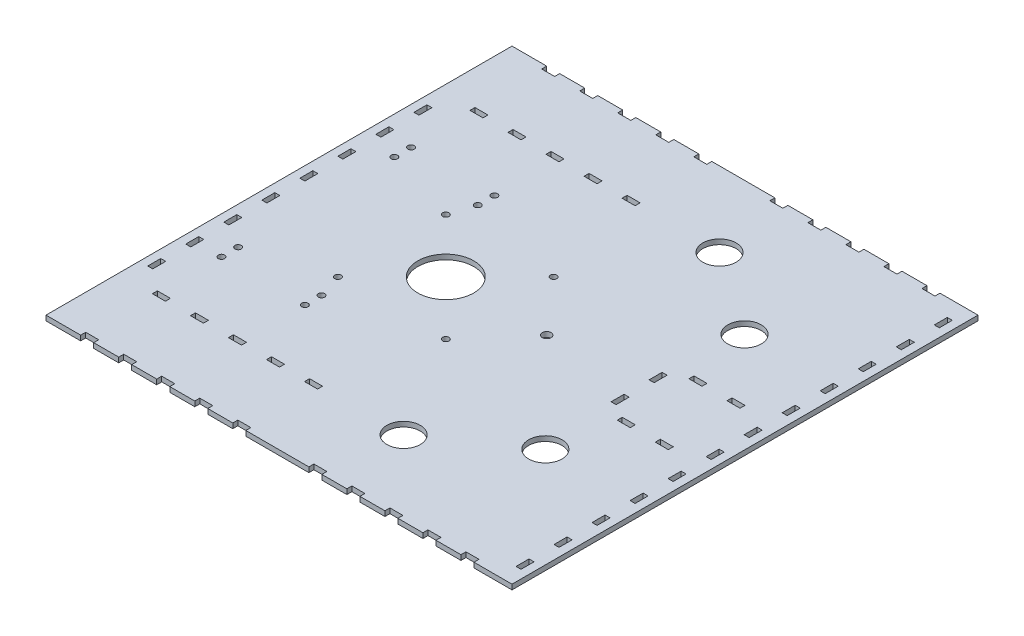
from build123d import *

# Parameters (mm, degrees)
SKETCH1_W                = 279.4
SKETCH1_H                = 279.4
BOSS_EXTRUDE1_DEPTH      = 3
SKETCH3_W                = 3
SKETCH3_H                = 7.8
CUT_EXTRUDE2_DEPTH       = 198.588410591
LPATTERN1_COUNT          = 12
LPATTERN1_PITCH          = 22.8
SKETCH5_W                = 7.8
SKETCH5_H                = 3
CUT_EXTRUDE3_DEPTH       = 198.588410591
LPATTERN2_COUNT          = 11
LPATTERN2_PITCH          = 22.8
MIRROR2_COPY_1_SKETCH_W  = 7.8
MIRROR2_COPY_1_SKETCH_H  = 3
MIRROR2_COPY_1_DEPTH     = 198.588410591
MIRROR2_COPY_2_SKETCH_W  = 7.8
MIRROR2_COPY_2_SKETCH_H  = 3
MIRROR2_COPY_2_DEPTH     = 198.588410591
MIRROR2_COPY_3_SKETCH_W  = 7.8
MIRROR2_COPY_3_SKETCH_H  = 3
MIRROR2_COPY_3_DEPTH     = 198.588410591
MIRROR2_COPY_4_SKETCH_W  = 7.8
MIRROR2_COPY_4_SKETCH_H  = 3
MIRROR2_COPY_4_DEPTH     = 198.588410591
MIRROR2_COPY_5_SKETCH_W  = 7.8
MIRROR2_COPY_5_SKETCH_H  = 3
MIRROR2_COPY_5_DEPTH     = 198.588410591
MIRROR2_COPY_6_SKETCH_W  = 7.8
MIRROR2_COPY_6_SKETCH_H  = 3
MIRROR2_COPY_6_DEPTH     = 198.588410591
MIRROR2_COPY_7_SKETCH_W  = 7.8
MIRROR2_COPY_7_SKETCH_H  = 3
MIRROR2_COPY_7_DEPTH     = 198.588410591
MIRROR2_COPY_8_SKETCH_W  = 7.8
MIRROR2_COPY_8_SKETCH_H  = 3
MIRROR2_COPY_8_DEPTH     = 198.588410591
MIRROR2_COPY_9_SKETCH_W  = 7.8
MIRROR2_COPY_9_SKETCH_H  = 3
MIRROR2_COPY_9_DEPTH     = 198.588410591
MIRROR2_COPY_10_SKETCH_W = 7.8
MIRROR2_COPY_10_SKETCH_H = 3
MIRROR2_COPY_10_DEPTH    = 198.588410591
SKETCH6_W                = 3
SKETCH6_H                = 7.8
CUT_EXTRUDE4_DEPTH       = 198.588410591
LPATTERN3_COUNT          = 8
LPATTERN3_PITCH          = 22.8
SKETCH7_R                = 16.75
CUT_EXTRUDE5_DEPTH       = 198.588410591
F_6_CLEARANCE_HOLE1_D    = 3.7973
F_6_CLEARANCE_HOLE2_D    = 3.7973
SKETCH14_R               = 2.65
CUT_EXTRUDE6_DEPTH       = 198.588410591
SKETCH16_W               = 7.8
SKETCH16_H               = 3
CUT_EXTRUDE8_DEPTH       = 198.588410591
LPATTERN5_COUNT          = 5
LPATTERN5_PITCH          = 22.8
MIRROR4_COPY_1_SKETCH_W  = 7.8
MIRROR4_COPY_1_SKETCH_H  = 3
MIRROR4_COPY_1_DEPTH     = 198.588410591
MIRROR4_COPY_2_SKETCH_W  = 7.8
MIRROR4_COPY_2_SKETCH_H  = 3
MIRROR4_COPY_2_DEPTH     = 198.588410591
MIRROR4_COPY_3_SKETCH_W  = 7.8
MIRROR4_COPY_3_SKETCH_H  = 3
MIRROR4_COPY_3_DEPTH     = 198.588410591
MIRROR4_COPY_4_SKETCH_W  = 7.8
MIRROR4_COPY_4_SKETCH_H  = 3
MIRROR4_COPY_4_DEPTH     = 198.588410591
MIRROR4_COPY_5_SKETCH_W  = 7.8
MIRROR4_COPY_5_SKETCH_H  = 3
MIRROR4_COPY_5_DEPTH     = 198.588410591
SKETCH17_W               = 7.8
SKETCH17_H               = 3
CUT_EXTRUDE9_DEPTH       = 198.588410591
LPATTERN6_COUNT          = 2
LPATTERN6_PITCH          = 22.8
SKETCH18_W               = 3
SKETCH18_H               = 7.8
CUT_EXTRUDE10_DEPTH      = 198.588410591
MIRROR5_COPY_1_SKETCH_W  = 7.8
MIRROR5_COPY_1_SKETCH_H  = 3
MIRROR5_COPY_1_DEPTH     = 198.588410591
SKETCH19_R               = 10
CUT_EXTRUDE11_DEPTH      = 198.588410591


with BuildPart() as part:
    # Sketch1 → Boss-Extrude1 (new body)
    with BuildSketch(Plane(origin=(0, 0, 0), x_dir=(1, 0, 0), z_dir=(0, 1, 0))):
        Rectangle(SKETCH1_W, SKETCH1_H)
    extrude(amount=BOSS_EXTRUDE1_DEPTH)

    # Sketch3 → Cut-Extrude2 (cut, through all)
    with BuildSketch(Plane(origin=(0, 0, 0), x_dir=(-1, 0, 0), z_dir=(0, -1, 0))):
        with Locations((-133.2, 125.4)):
            Rectangle(SKETCH3_W, SKETCH3_H)
    cut_extrude2 = extrude(amount=-CUT_EXTRUDE2_DEPTH, mode=Mode.SUBTRACT)

    # LPattern1: Cut-Extrude2 ×12
    with Locations(*[(0, 0, i * LPATTERN1_PITCH) for i in range(1, LPATTERN1_COUNT)]):
        add(cut_extrude2, mode=Mode.SUBTRACT)

    # Sketch5 → Cut-Extrude3 (cut, through all)
    with BuildSketch(Plane.XZ):
        with Locations((113, -138.2)):
            Rectangle(SKETCH5_W, SKETCH5_H)
    cut_extrude3 = extrude(amount=-CUT_EXTRUDE3_DEPTH, mode=Mode.SUBTRACT)

    # LPattern2: Cut-Extrude3 ×11, 1 skipped
    with Locations(*[(-i * LPATTERN2_PITCH, 0, 0) for i in range(1, LPATTERN2_COUNT) if i not in (5,)]):
        add(cut_extrude3, mode=Mode.SUBTRACT)

    # Mirror2 copy 1 sketch → Mirror2 copy 1 (cut, through all)
    with BuildSketch(Plane(origin=(-22.8, 0, 0), x_dir=(1, 0, 0), z_dir=(0, -1, 0))):
        with Locations((113, 138.2)):
            Rectangle(MIRROR2_COPY_1_SKETCH_W, MIRROR2_COPY_1_SKETCH_H)
    extrude(amount=-MIRROR2_COPY_1_DEPTH, mode=Mode.SUBTRACT)

    # Mirror2 copy 2 sketch → Mirror2 copy 2 (cut, through all)
    with BuildSketch(Plane(origin=(-45.6, 0, 0), x_dir=(1, 0, 0), z_dir=(0, -1, 0))):
        with Locations((113, 138.2)):
            Rectangle(MIRROR2_COPY_2_SKETCH_W, MIRROR2_COPY_2_SKETCH_H)
    extrude(amount=-MIRROR2_COPY_2_DEPTH, mode=Mode.SUBTRACT)

    # Mirror2 copy 3 sketch → Mirror2 copy 3 (cut, through all)
    with BuildSketch(Plane(origin=(-68.4, 0, 0), x_dir=(1, 0, 0), z_dir=(0, -1, 0))):
        with Locations((113, 138.2)):
            Rectangle(MIRROR2_COPY_3_SKETCH_W, MIRROR2_COPY_3_SKETCH_H)
    extrude(amount=-MIRROR2_COPY_3_DEPTH, mode=Mode.SUBTRACT)

    # Mirror2 copy 4 sketch → Mirror2 copy 4 (cut, through all)
    with BuildSketch(Plane(origin=(-91.2, 0, 0), x_dir=(1, 0, 0), z_dir=(0, -1, 0))):
        with Locations((113, 138.2)):
            Rectangle(MIRROR2_COPY_4_SKETCH_W, MIRROR2_COPY_4_SKETCH_H)
    extrude(amount=-MIRROR2_COPY_4_DEPTH, mode=Mode.SUBTRACT)

    # Mirror2 copy 5 sketch → Mirror2 copy 5 (cut, through all)
    with BuildSketch(Plane(origin=(-136.8, 0, 0), x_dir=(1, 0, 0), z_dir=(0, -1, 0))):
        with Locations((113, 138.2)):
            Rectangle(MIRROR2_COPY_5_SKETCH_W, MIRROR2_COPY_5_SKETCH_H)
    extrude(amount=-MIRROR2_COPY_5_DEPTH, mode=Mode.SUBTRACT)

    # Mirror2 copy 6 sketch → Mirror2 copy 6 (cut, through all)
    with BuildSketch(Plane(origin=(-159.6, 0, 0), x_dir=(1, 0, 0), z_dir=(0, -1, 0))):
        with Locations((113, 138.2)):
            Rectangle(MIRROR2_COPY_6_SKETCH_W, MIRROR2_COPY_6_SKETCH_H)
    extrude(amount=-MIRROR2_COPY_6_DEPTH, mode=Mode.SUBTRACT)

    # Mirror2 copy 7 sketch → Mirror2 copy 7 (cut, through all)
    with BuildSketch(Plane(origin=(-182.4, 0, 0), x_dir=(1, 0, 0), z_dir=(0, -1, 0))):
        with Locations((113, 138.2)):
            Rectangle(MIRROR2_COPY_7_SKETCH_W, MIRROR2_COPY_7_SKETCH_H)
    extrude(amount=-MIRROR2_COPY_7_DEPTH, mode=Mode.SUBTRACT)

    # Mirror2 copy 8 sketch → Mirror2 copy 8 (cut, through all)
    with BuildSketch(Plane(origin=(-205.2, 0, 0), x_dir=(1, 0, 0), z_dir=(0, -1, 0))):
        with Locations((113, 138.2)):
            Rectangle(MIRROR2_COPY_8_SKETCH_W, MIRROR2_COPY_8_SKETCH_H)
    extrude(amount=-MIRROR2_COPY_8_DEPTH, mode=Mode.SUBTRACT)

    # Mirror2 copy 9 sketch → Mirror2 copy 9 (cut, through all)
    with BuildSketch(Plane(origin=(-228, 0, 0), x_dir=(1, 0, 0), z_dir=(0, -1, 0))):
        with Locations((113, 138.2)):
            Rectangle(MIRROR2_COPY_9_SKETCH_W, MIRROR2_COPY_9_SKETCH_H)
    extrude(amount=-MIRROR2_COPY_9_DEPTH, mode=Mode.SUBTRACT)

    # Mirror2 copy 10 sketch → Mirror2 copy 10 (cut, through all)
    with BuildSketch(Plane.XZ):
        with Locations((113, 138.2)):
            Rectangle(MIRROR2_COPY_10_SKETCH_W, MIRROR2_COPY_10_SKETCH_H)
    extrude(amount=-MIRROR2_COPY_10_DEPTH, mode=Mode.SUBTRACT)

    # Sketch6 → Cut-Extrude4 (cut, through all)
    with BuildSketch(Plane.XZ):
        with Locations((-133.2, -79.8)):
            Rectangle(SKETCH6_W, SKETCH6_H)
    cut_extrude4 = extrude(amount=-CUT_EXTRUDE4_DEPTH, mode=Mode.SUBTRACT)

    # LPattern3: Cut-Extrude4 ×8
    with Locations(*[(0, 0, i * LPATTERN3_PITCH) for i in range(1, LPATTERN3_COUNT)]):
        add(cut_extrude4, mode=Mode.SUBTRACT)

    # Sketch7 → Cut-Extrude5 (cut, through all)
    with BuildSketch(Plane(origin=(0, 0, 0), x_dir=(-1, 0, 0), z_dir=(0, -1, 0))):
        with Locations((39.7, 0)):
            Circle(SKETCH7_R)
    extrude(amount=-CUT_EXTRUDE5_DEPTH, mode=Mode.SUBTRACT)

    # #6 Clearance Hole1 (through all)
    with Locations(Plane(origin=(0, 3, 0), x_dir=(1, 0, 0), z_dir=(0, 1, 0))):
        with Locations((-72.025, -32.325), (-72.025, 32.325), (-7.375, 32.325), (-7.375, -32.325)):
            Hole(F_6_CLEARANCE_HOLE1_D / 2)

    # #6 Clearance Hole2 (through all)
    with Locations(Plane(origin=(0, 3, 0), x_dir=(1, 0, 0), z_dir=(0, 1, 0))):
        with Locations((-117.36, 56.83), (-67.36, 56.83), (-117.36, -56.83), (-67.36, -56.83), (-67.36, -46.83), (-117.36, -46.83), (-67.36, 46.83), (-117.36, 46.83)):
            Hole(F_6_CLEARANCE_HOLE2_D / 2)

    # Sketch14 → Cut-Extrude6 (cut, through all)
    with BuildSketch(Plane(origin=(0, 0, 0), x_dir=(-1, 0, 0), z_dir=(0, -1, 0))):
        with Locations((-20.8, 0)):
            Circle(SKETCH14_R)
    extrude(amount=-CUT_EXTRUDE6_DEPTH, mode=Mode.SUBTRACT)

    # Sketch16 → Cut-Extrude8 (cut, through all)
    with BuildSketch(Plane.XZ):
        with Locations((-115, 95.2)):
            Rectangle(SKETCH16_W, SKETCH16_H)
    cut_extrude8 = extrude(amount=-CUT_EXTRUDE8_DEPTH, mode=Mode.SUBTRACT)

    # LPattern5: Cut-Extrude8 ×5
    with Locations(*[(i * LPATTERN5_PITCH, 0, 0) for i in range(1, LPATTERN5_COUNT)]):
        add(cut_extrude8, mode=Mode.SUBTRACT)

    # Mirror4 copy 1 sketch → Mirror4 copy 1 (cut, through all)
    with BuildSketch(Plane(origin=(22.8, 0, 0), x_dir=(1, 0, 0), z_dir=(0, -1, 0))):
        with Locations((-115, -95.2)):
            Rectangle(MIRROR4_COPY_1_SKETCH_W, MIRROR4_COPY_1_SKETCH_H)
    extrude(amount=-MIRROR4_COPY_1_DEPTH, mode=Mode.SUBTRACT)

    # Mirror4 copy 2 sketch → Mirror4 copy 2 (cut, through all)
    with BuildSketch(Plane(origin=(45.6, 0, 0), x_dir=(1, 0, 0), z_dir=(0, -1, 0))):
        with Locations((-115, -95.2)):
            Rectangle(MIRROR4_COPY_2_SKETCH_W, MIRROR4_COPY_2_SKETCH_H)
    extrude(amount=-MIRROR4_COPY_2_DEPTH, mode=Mode.SUBTRACT)

    # Mirror4 copy 3 sketch → Mirror4 copy 3 (cut, through all)
    with BuildSketch(Plane(origin=(68.4, 0, 0), x_dir=(1, 0, 0), z_dir=(0, -1, 0))):
        with Locations((-115, -95.2)):
            Rectangle(MIRROR4_COPY_3_SKETCH_W, MIRROR4_COPY_3_SKETCH_H)
    extrude(amount=-MIRROR4_COPY_3_DEPTH, mode=Mode.SUBTRACT)

    # Mirror4 copy 4 sketch → Mirror4 copy 4 (cut, through all)
    with BuildSketch(Plane(origin=(91.2, 0, 0), x_dir=(1, 0, 0), z_dir=(0, -1, 0))):
        with Locations((-115, -95.2)):
            Rectangle(MIRROR4_COPY_4_SKETCH_W, MIRROR4_COPY_4_SKETCH_H)
    extrude(amount=-MIRROR4_COPY_4_DEPTH, mode=Mode.SUBTRACT)

    # Mirror4 copy 5 sketch → Mirror4 copy 5 (cut, through all)
    with BuildSketch(Plane.XZ):
        with Locations((-115, -95.2)):
            Rectangle(MIRROR4_COPY_5_SKETCH_W, MIRROR4_COPY_5_SKETCH_H)
    extrude(amount=-MIRROR4_COPY_5_DEPTH, mode=Mode.SUBTRACT)

    # Sketch17 → Cut-Extrude9 (cut, through all)
    with BuildSketch(Plane.XZ):
        with Locations((112.8, 21.5)):
            Rectangle(SKETCH17_W, SKETCH17_H)
    cut_extrude9 = extrude(amount=-CUT_EXTRUDE9_DEPTH, mode=Mode.SUBTRACT)

    # LPattern6: Cut-Extrude9 ×2
    with Locations(*[(-i * LPATTERN6_PITCH, 0, 0) for i in range(1, LPATTERN6_COUNT)]):
        add(cut_extrude9, mode=Mode.SUBTRACT)

    # Sketch18 → Cut-Extrude10 (cut, through all)
    with BuildSketch(Plane(origin=(0, 0, 0), x_dir=(-1, 0, 0), z_dir=(0, -1, 0))):
        with Locations((-76.2, -11.4)):
            Rectangle(SKETCH18_W, SKETCH18_H)
    cut_extrude10 = extrude(amount=-CUT_EXTRUDE10_DEPTH, mode=Mode.SUBTRACT)

    # Mirror5: Cut-Extrude9, Cut-Extrude10 across plane
    add(cut_extrude9.mirror(Plane.XY), mode=Mode.SUBTRACT)
    add(cut_extrude10.mirror(Plane.XY), mode=Mode.SUBTRACT)

    # Mirror5 copy 1 sketch → Mirror5 copy 1 (cut, through all)
    with BuildSketch(Plane(origin=(-22.8, 0, 0), x_dir=(1, 0, 0), z_dir=(0, -1, 0))):
        with Locations((112.8, -21.5)):
            Rectangle(MIRROR5_COPY_1_SKETCH_W, MIRROR5_COPY_1_SKETCH_H)
    extrude(amount=-MIRROR5_COPY_1_DEPTH, mode=Mode.SUBTRACT)

    # Sketch19 → Cut-Extrude11 (cut, through all)
    with BuildSketch(Plane.XZ):
        with Locations((29.7, 94.7)):
            Circle(SKETCH19_R)
        with Locations((79.7, 59.7)):
            Circle(SKETCH19_R)
        with Locations((29.7, -94.7)):
            Circle(SKETCH19_R)
        with Locations((79.7, -59.7)):
            Circle(SKETCH19_R)
    extrude(amount=-CUT_EXTRUDE11_DEPTH, mode=Mode.SUBTRACT)


solid = part.part
